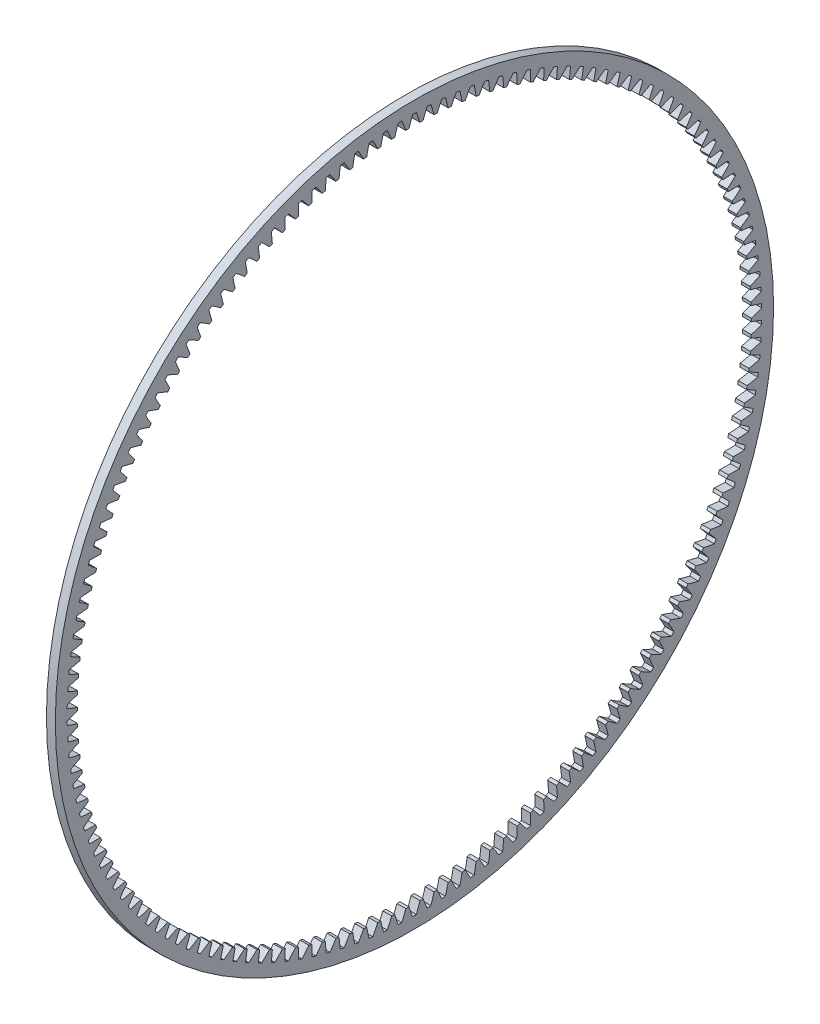
from build123d import *

# Parameters (mm, degrees)
BASPROSKE_W     = 12.7
BASPROSKE_H     = 31.5
TOOTHCUT_DEPTH  = 725.89570974
TEETHCUTS_COUNT = 150
TEETHCUTS_ANGLE = 357.6


with BuildPart() as part:
    # BasProSke → Base-Revolve (revolve)
    with BuildSketch(Plane(origin=(0, 0, 0), x_dir=(1, 0, 0), z_dir=(0, 1, 0)), mode=Mode.PRIVATE) as base_revolve_sk:
        with Locations((6.35, 496.75)):
            Rectangle(BASPROSKE_W, BASPROSKE_H)
    revolve(base_revolve_sk.sketch.rotate(Axis((-10, 0, 0), (1, 0, 0)), 180), axis=Axis((-10, 0, 0), (1, 0, 0)))

    # TooCutSke → ToothCut (cut, through all)
    with BuildSketch(Plane(origin=(0, 0, 0), x_dir=(0, 0, -1), z_dir=(1, 0, 0))):
        with BuildLine():
            ThreePointArc((7.820334899, 480.911019012), (5.360144977, 488.306143417), (2.66479263, 495.61883616))
            ThreePointArc((2.66479263, 495.61883616), (0, 495.626), (-2.66479263, 495.61883616))
            ThreePointArc((-2.66479263, 495.61883616), (-5.360144977, 488.306143417), (-7.820334899, 480.911019012))
            ThreePointArc((-7.820334899, 480.911019012), (0, 480.9746), (7.820334899, 480.911019012))
        make_face()
    toothcut = extrude(amount=TOOTHCUT_DEPTH, mode=Mode.SUBTRACT)

    # TeethCuts: ToothCut ×150 about axis
    teethcuts_axis = Axis((-10, 0, 0), (1, 0, 0))
    for i in range(1, TEETHCUTS_COUNT):
        add(toothcut.rotate(teethcuts_axis, i * TEETHCUTS_ANGLE / (TEETHCUTS_COUNT - 1)), mode=Mode.SUBTRACT)


solid = part.part
